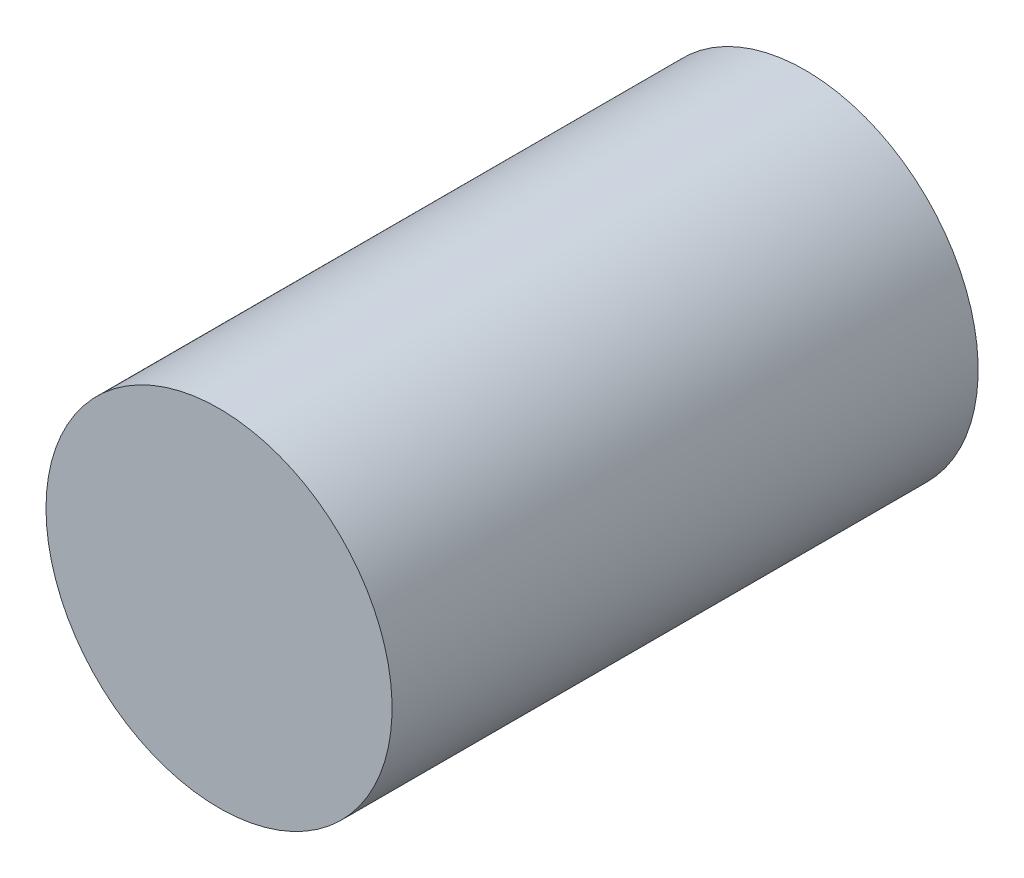
from build123d import *

# Parameters (mm, degrees)
SKETCH1_R      = 6.2
ENVELOPE_DEPTH = 21


with BuildPart() as part:
    # Sketch1 → Envelope (new body)
    with BuildSketch(Plane.XY):
        Circle(SKETCH1_R)
    extrude(amount=ENVELOPE_DEPTH)


solid = part.part
